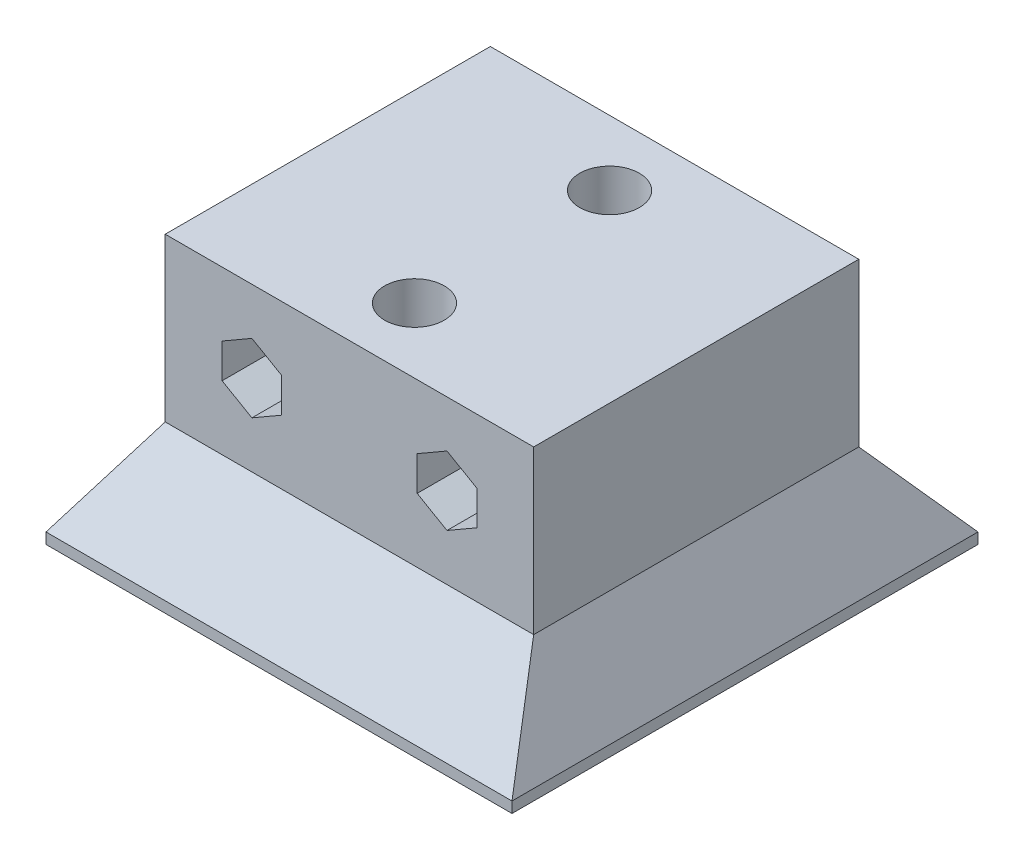
from build123d import *

# Parameters (mm, degrees)
SKETCH1_W                = 34
SKETCH1_H                = 15
BOSS_EXTRUDE1_DEPTH      = 30
BOSS_EXTRUDE2_DEPTH      = 6.5
BOSS_EXTRUDE2_DEPTH_BACK = 36.5
CUT_EXTRUDE2_DEPTH       = 56.131660595
CUT_EXTRUDE3_DEPTH       = 56.131660595
CUT_EXTRUDE3_DEPTH_BACK  = 56.131660595
SKETCH7_R                = 2.75
CUT_EXTRUDE4_DEPTH       = 59.143489027


with BuildPart() as part:
    # Sketch1 → Boss-Extrude1 (new body)
    with BuildSketch(Plane.XY):
        with Locations((17, 7.5)):
            Rectangle(SKETCH1_W, SKETCH1_H)
    extrude(amount=BOSS_EXTRUDE1_DEPTH)

    # Sketch3 → Boss-Extrude2 (add, two sides: drawn at the far end of the back side and taken through both)
    with BuildSketch(Plane.XY.offset(30).offset(-BOSS_EXTRUDE2_DEPTH_BACK)):
        Polygon((0, 0), (-4.5, -7.794228634), (-4.5, -8.794228634), (38.5, -8.794228634), (38.5, -7.794228634), (34, 0), align=None)
    extrude(amount=BOSS_EXTRUDE2_DEPTH + BOSS_EXTRUDE2_DEPTH_BACK)

    # Sketch5 → Cut-Extrude2 (cut, through all)
    with BuildSketch(Plane.XY.offset(30)):
        Polygon((8, 4.324573519), (10.75, 5.91228676), (10.75, 9.08771324), (8, 10.675426481), (5.25, 9.08771324), (5.25, 5.91228676), align=None)
        Polygon((26, 4.324573519), (28.75, 5.91228676), (28.75, 9.08771324), (26, 10.675426481), (23.25, 9.08771324), (23.25, 5.91228676), align=None)
    extrude(amount=-CUT_EXTRUDE2_DEPTH, mode=Mode.SUBTRACT)

    # Sketch6 → Cut-Extrude3 (cut, two sides: drawn at the far end of the back side and taken through both)
    with BuildSketch(Plane.ZY.offset(-CUT_EXTRUDE3_DEPTH_BACK)):
        Polygon((30, 0), (36.5, -7.794228634), (36.5, 0), align=None)
        Polygon((0, 0), (-6.5, -7.794228634), (-6.5, 0), align=None)
    extrude(amount=CUT_EXTRUDE3_DEPTH + CUT_EXTRUDE3_DEPTH_BACK, mode=Mode.SUBTRACT)

    # Sketch7 → Cut-Extrude4 (cut, through all)
    with BuildSketch(Plane(origin=(0, 15, 0), x_dir=(1, 0, 0), z_dir=(0, 1, 0))):
        with Locations((17, -6)):
            Circle(SKETCH7_R)
        with Locations((17, -24)):
            Circle(SKETCH7_R)
    extrude(amount=-CUT_EXTRUDE4_DEPTH, mode=Mode.SUBTRACT)


solid = part.part
